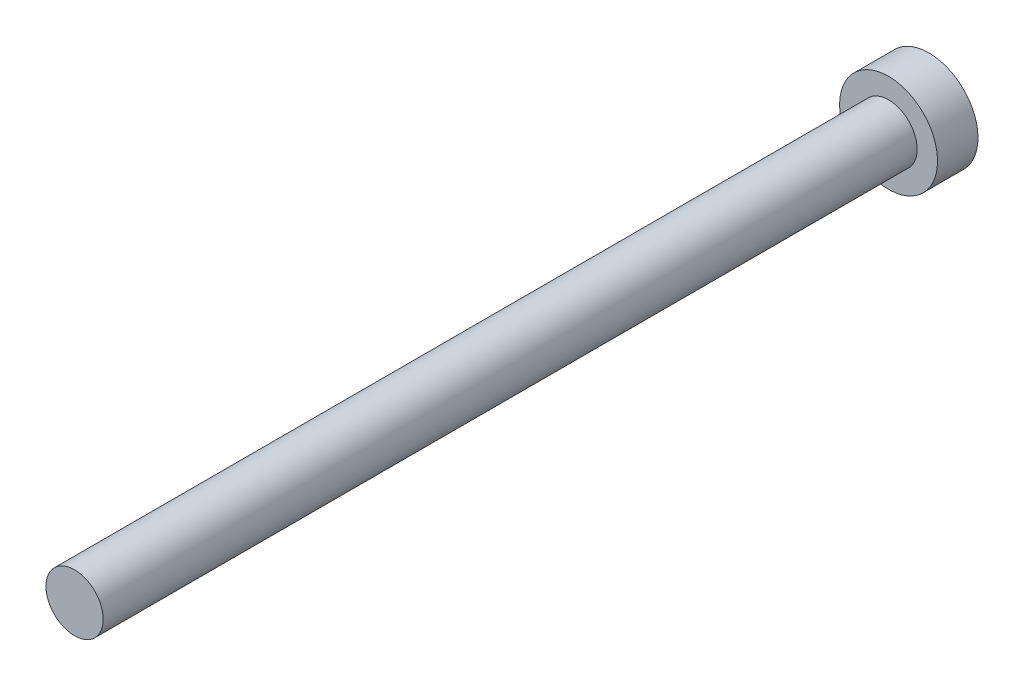
from build123d import *

# Parameters (mm, degrees)
SKETCH1_R                           = 1.5
BOSS_EXTRUDE1_DEPTH                 = 42
SKETCH2_R                           = 2.75
BOSS_EXTRUDE2_DEPTH                 = 2.2
ESCALA1_SCALE                       = 1.5
ESCALA2_SCALE                       = 1.5
CROQUIS1_R                          = 3.5
SALIENTE_EXTRUIR1_DEPTH             = 10
SALIENTE_EXTRUIR1_DIRECTION_2_REACH = 96.904
CORTAR_EXTRUIR1_DEPTH               = 105.865725156
CORTAR_EXTRUIR1_DEPTH_BACK          = 105.865725156
CROQUIS2_OUTSIDE_W                  = 35.568
CROQUIS2_OUTSIDE_H                  = 35.568
CROQUIS2_OUTSIDE_R                  = 5.99


with BuildPart() as part:
    # Sketch1 → Boss-Extrude1 (new body)
    with BuildSketch(Plane.XY):
        Circle(SKETCH1_R)
    extrude(amount=BOSS_EXTRUDE1_DEPTH)

    # Sketch2 → Boss-Extrude2 (add)
    with BuildSketch(Plane(origin=(0, 0, 0), x_dir=(-1, 0, 0), z_dir=(0, 0, -1))):
        Circle(SKETCH2_R)
    extrude(amount=-BOSS_EXTRUDE2_DEPTH)


with BuildPart() as part_1:
    # Escala1: scaled about (0, 0, 0)
    add(part.part.scale(ESCALA1_SCALE))


with BuildPart() as part_2:
    # Escala2: scaled about (0, 0, 0)
    add(part_1.part.scale(ESCALA2_SCALE))

    # Croquis1 → Saliente-Extruir1 (add)
    with BuildSketch(Plane.XY.offset(94.5)):
        Circle(CROQUIS1_R)
    extrude(amount=SALIENTE_EXTRUIR1_DEPTH)

    # Croquis1 → Saliente-Extruir1 direction 2 (add, up to next)
    with BuildSketch(Plane.XY.offset(94.5), mode=Mode.PRIVATE) as saliente_extruir1_direction_2_sk1:
        Circle(CROQUIS1_R)
    saliente_extruir1_direction_2_tool1 = extrude(saliente_extruir1_direction_2_sk1.sketch, amount=-SALIENTE_EXTRUIR1_DIRECTION_2_REACH, mode=Mode.PRIVATE) - part_2.part
    add(saliente_extruir1_direction_2_tool1.solids().sort_by_distance((0, 0, 94.5))[0])

    # Croquis2 outside → Cortar-Extruir1 (cut, two sides: drawn at the far end of the back side and taken through both)
    with BuildSketch(Plane(origin=(0, 0, 0), x_dir=(-1, 0, 0), z_dir=(0, 0, -1)).offset(-CORTAR_EXTRUIR1_DEPTH_BACK)):
        Rectangle(CROQUIS2_OUTSIDE_W, CROQUIS2_OUTSIDE_H)
        Circle(CROQUIS2_OUTSIDE_R, mode=Mode.SUBTRACT)
    extrude(amount=CORTAR_EXTRUIR1_DEPTH + CORTAR_EXTRUIR1_DEPTH_BACK, mode=Mode.SUBTRACT)


solid = part_2.part
